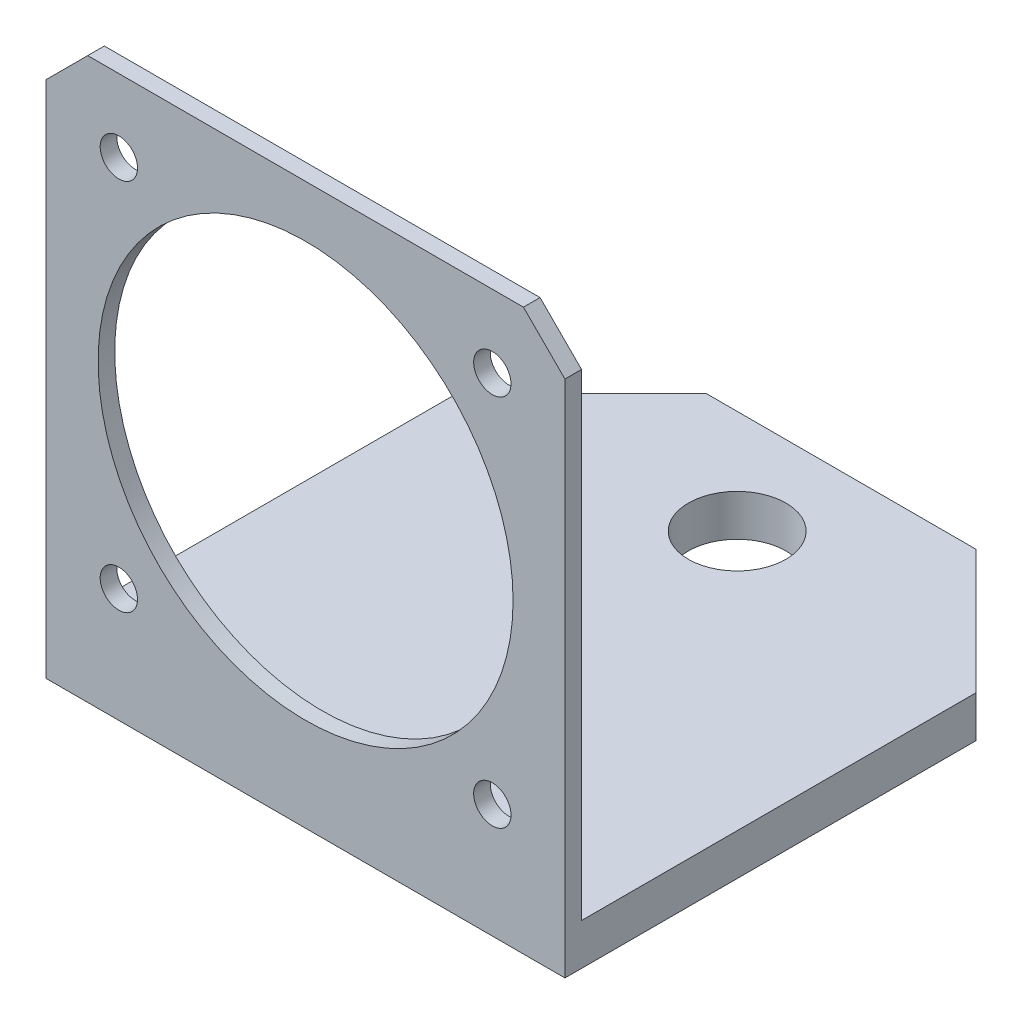
from build123d import *

# Parameters (mm, degrees)
SKETCH1_W           = 31.75
SKETCH1_H           = 31.75
SKETCH1_R           = 1.143
SKETCH1_R_2         = 12.7
BOSS_EXTRUDE1_DEPTH = 1.016
CHAMFER1_SIZE       = 2.54
SKETCH2_W           = 31.75
SKETCH2_H           = 32.766
BOSS_EXTRUDE2_DEPTH = 2.54
SKETCH3_R           = 2.9845
CUT_EXTRUDE1_DEPTH  = 48.625
CHAMFER2_SIZE       = 7.62


with BuildPart() as part:
    # Sketch1 → Boss-Extrude1 (new body)
    with BuildSketch(Plane.XY):
        Rectangle(SKETCH1_W, SKETCH1_H)
        with Locations((-11.43, 11.43)):
            Circle(SKETCH1_R, mode=Mode.SUBTRACT)
        with Locations((11.43, 11.43)):
            Circle(SKETCH1_R, mode=Mode.SUBTRACT)
        with Locations((-11.43, -11.43)):
            Circle(SKETCH1_R, mode=Mode.SUBTRACT)
        with Locations((11.43, -11.43)):
            Circle(SKETCH1_R, mode=Mode.SUBTRACT)
        Circle(SKETCH1_R_2, mode=Mode.SUBTRACT)
    extrude(amount=BOSS_EXTRUDE1_DEPTH)

    # Chamfer1
    chamfer1_edges = [part.edges().sort_by_distance(p)[0] for p in [
        (-15.875, 15.875, 0.508),
        (15.875, 15.875, 0.508),
    ]]
    chamfer(chamfer1_edges, length=CHAMFER1_SIZE)

    # Sketch2 → Boss-Extrude2 (add)
    with BuildSketch(Plane.XZ.offset(15.875)):
        with Locations((0, -15.367)):
            Rectangle(SKETCH2_W, SKETCH2_H)
    extrude(amount=BOSS_EXTRUDE2_DEPTH)

    # Sketch3 → Cut-Extrude1 (cut, through all)
    with BuildSketch(Plane(origin=(0, -15.875, 0), x_dir=(1, 0, 0), z_dir=(0, 1, 0))):
        with Locations((0, 25.4)):
            Circle(SKETCH3_R)
    extrude(amount=-CUT_EXTRUDE1_DEPTH, mode=Mode.SUBTRACT)

    # Chamfer2
    chamfer2_edges = [part.edges().sort_by_distance(p)[0] for p in [
        (15.875, -17.145, -31.75),
        (-15.875, -17.145, -31.75),
    ]]
    chamfer(chamfer2_edges, length=CHAMFER2_SIZE)


solid = part.part
